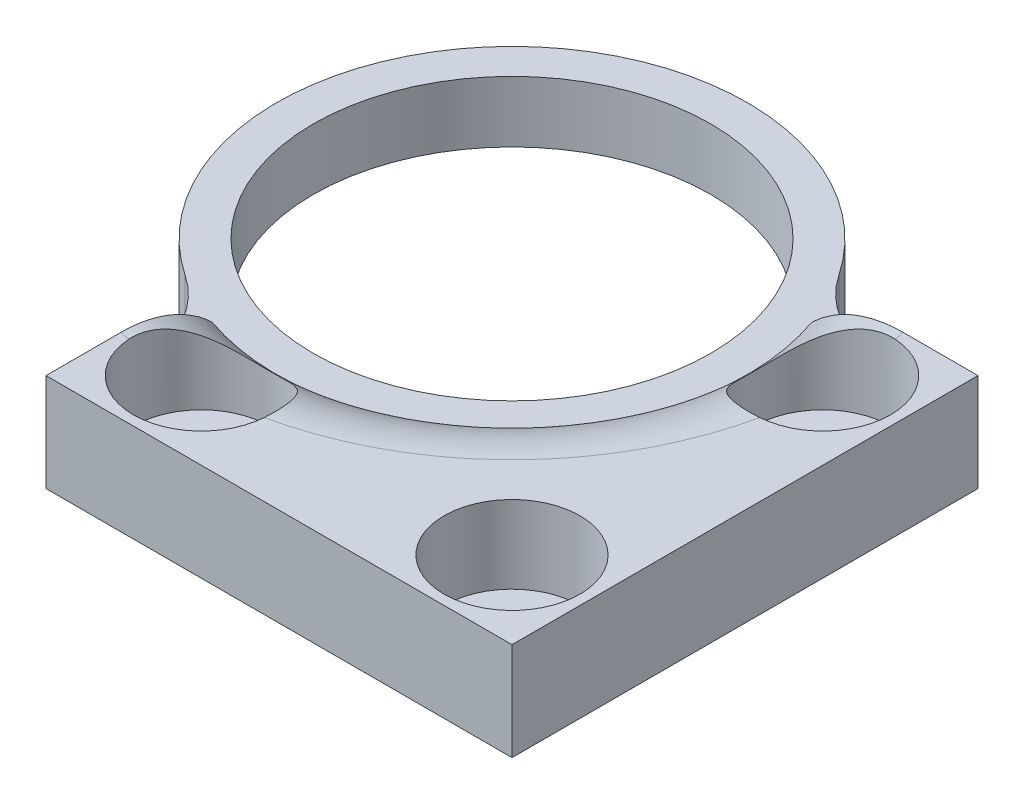
from build123d import *

# Parameters (mm, degrees)
SKETCH1_R                                        = 19.25
SKETCH1_R_2                                      = 16.25
BOSS_EXTRUDE1_DEPTH                              = 5
BOSS_EXTRUDE2_DEPTH                              = 8
CBORE_FOR_1_4_SOCKET_HEAD_CAP_SCREW2_D           = 6.7564
CBORE_FOR_1_4_SOCKET_HEAD_CAP_SCREW2_CBORE_D     = 11.1125
CBORE_FOR_1_4_SOCKET_HEAD_CAP_SCREW2_CBORE_DEPTH = 6.35
FILLET1_R                                        = 10


with BuildPart() as part:
    # Sketch1 → Boss-Extrude1 (new body)
    with BuildSketch(Plane(origin=(0, 0, 0), x_dir=(1, 0, 0), z_dir=(0, 1, 0))):
        with Locations(Location((0, 0, 0), (0, 0, 270))):
            Circle(SKETCH1_R)
        with Locations(Location((0, 0, 0), (0, 0, 270))):
            Circle(SKETCH1_R_2, mode=Mode.SUBTRACT)
    extrude(amount=BOSS_EXTRUDE1_DEPTH)

    # Sketch2 → Boss-Extrude2 (add)
    with BuildSketch(Plane(origin=(0, 0, 0), x_dir=(1, 0, 0), z_dir=(0, 1, 0))):
        with BuildLine():
            Line((-6.35, -31.75), (31.75, -31.75))
            Line((31.75, -31.75), (31.75, 6.35))
            Line((31.75, 6.35), (18.172506707, 6.35))
            ThreePointArc((18.172506707, 6.35), (18.978715105, 3.220383975), (19.25, 0))
            ThreePointArc((19.25, 0), (11.142822802, -15.697133496), (-6.35, -18.172506707))
            Line((-6.35, -18.172506707), (-6.35, -31.75))
        make_face()
    extrude(amount=BOSS_EXTRUDE2_DEPTH)

    # CBORE for 1/4 Socket Head Cap Screw2 (through all)
    with Locations(Plane(origin=(0, 8, 0), x_dir=(1, 0, 0), z_dir=(0, 1, 0))):
        with Locations((0, -25.4), (25.4, -25.4), (25.4, 0)):
            CounterBoreHole(CBORE_FOR_1_4_SOCKET_HEAD_CAP_SCREW2_D / 2, CBORE_FOR_1_4_SOCKET_HEAD_CAP_SCREW2_CBORE_D / 2, CBORE_FOR_1_4_SOCKET_HEAD_CAP_SCREW2_CBORE_DEPTH)

    # Fillet1
    # the kernel refuses this fillet: 10 mm, written as the material it adds along each edge
    with BuildSketch(Plane(origin=(18.172506707, 0, -6.35), x_dir=(-0.4481163543899531, 0, -0.8939752417870743), z_dir=(0, 1, 0))) as fillet1_piece_1:
        with BuildLine():
            CenterArc((6.21468839, -9.917563599), FILLET1_R, 97.362002187, 56.015102529)
            Line((-2.725064028, -5.436400055), (0, 0))
            ThreePointArc((0, 0), (2.46665467, -0.158690073), (4.93330934, 0))
        make_face()
    extrude(amount=5)
    with BuildSketch(Plane(origin=(-6.35, 0, 18.172506707), x_dir=(-0.8939752417870848, 0, -0.44811635438993225), z_dir=(0, 1, 0))) as fillet1_piece_2:
        with BuildLine():
            CenterArc((6.21468839, 9.917563599), FILLET1_R, 206.622895283, 56.015102529)
            Line((-2.725064028, 5.436400055), (0, 0))
            ThreePointArc((0, 0), (2.46665467, 0.158690073), (4.93330934, 0))
        make_face()
    extrude(amount=5)
    # the kernel refuses this fillet: 10 mm, written as the material it takes off along each edge
    with BuildSketch(Plane(origin=(0, 8, 0), x_dir=(-0.9534219544060213, 0, 0.3016398131159126), z_dir=(-0.3016398131159126, 0, -0.9534219544060213))) as fillet1_2_piece_1:
        with BuildLine():
            CenterArc((26.391428429, -10), FILLET1_R, 90, 45.572995999)
            Line((26.391428429, 0), (19.25, 0))
            Line((19.25, 0), (19.25, -3))
        make_face()
    revolve(axis=Axis((0, 8, 0), (0, 1, 0)), revolution_arc=234.887758498, mode=Mode.SUBTRACT)


solid = part.part
